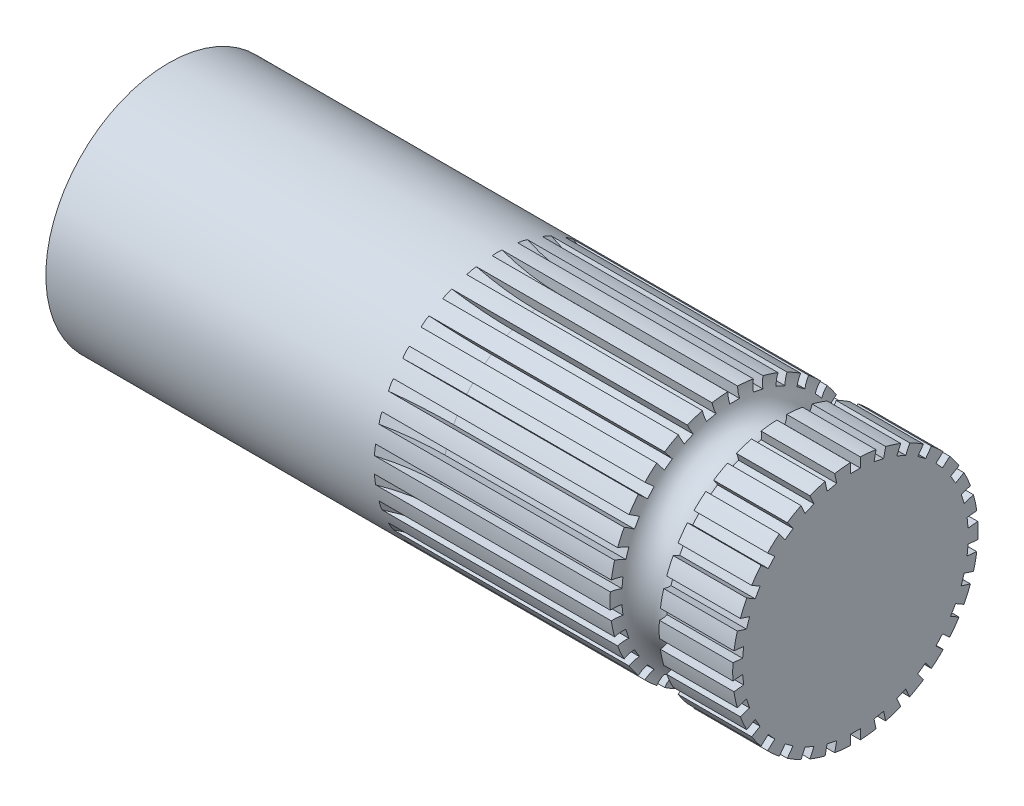
from build123d import *

# Parameters (mm, degrees)
SKETCH1_W         = 70
SKETCH1_H         = 12.5
SKETCH4_W         = 1
SKETCH4_H         = 3.596889259
CIRPATTERN1_COUNT = 30
SKETCH5_R         = 2.5


with BuildPart() as part:
    # Sketch1 → Revolve1 (revolve)
    with BuildSketch(Plane.XY):
        with Locations((35, 6.25)):
            Rectangle(SKETCH1_W, SKETCH1_H)
    revolve(axis=Axis((0, 0, 0), (1, 0, 0)))

    # Cut-Sweep1: sweep along a path in Sketch3
    with BuildLine(Plane.XY) as cut_sweep1_path:
        Line((70, 12.5), (39.265594891, 12.5))
        ThreePointArc((39.265594891, 12.5), (31.01213183, 14.738106201), (25.020026678, 20.839208374))
    # Sketch4 → Cut-Sweep1 (sweep, cut)
    with BuildSketch(Plane(origin=(70, 0, 0), x_dir=(0, 0, -1), z_dir=(1, 0, 0))):
        with Locations((0, 13.29844463)):
            Rectangle(SKETCH4_W, SKETCH4_H)
    cut_sweep1 = sweep(path=cut_sweep1_path.line, mode=Mode.SUBTRACT)

    # CirPattern1: Cut-Sweep1 ×30 about axis
    cirpattern1_axis = Axis((0, 0, 0), (-1, 0, 0))
    for i in range(1, CIRPATTERN1_COUNT):
        add(cut_sweep1.rotate(cirpattern1_axis, i * 360 / CIRPATTERN1_COUNT), mode=Mode.SUBTRACT)

    # Sketch5 → Cut-Revolve1 (revolve, cut)
    with BuildSketch(Plane.XY):
        with Locations((60, 12.489995997)):
            Circle(SKETCH5_R)
    revolve(axis=Axis((0, 0, 0), (1, 0, 0)), mode=Mode.SUBTRACT)


solid = part.part
